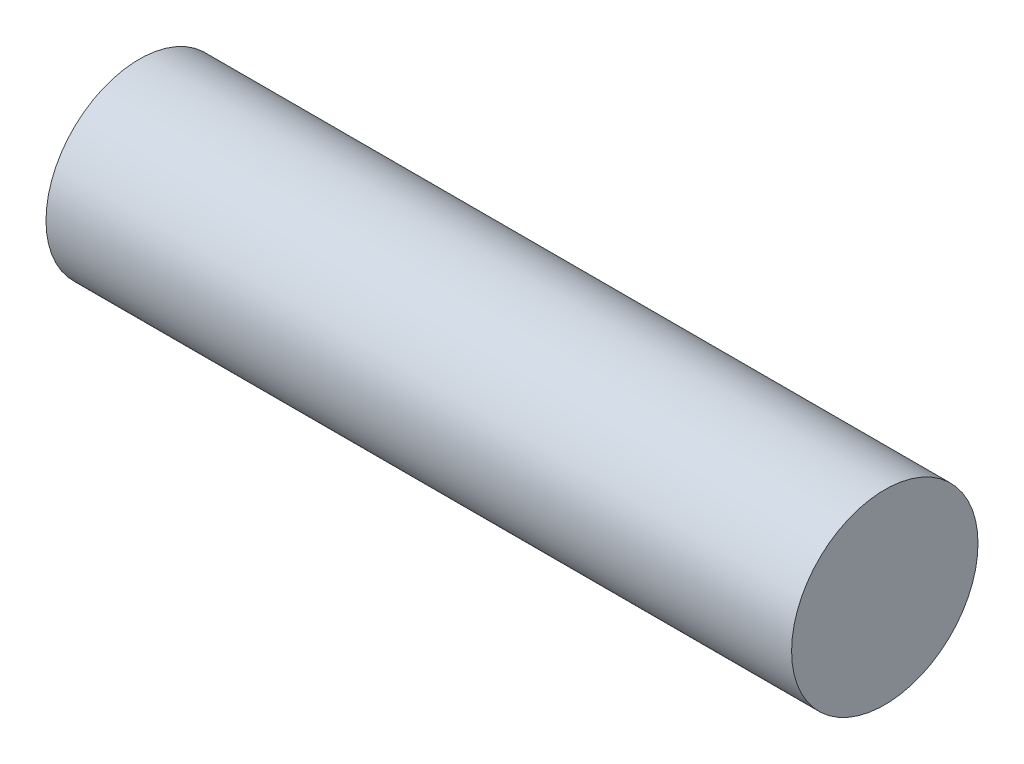
from build123d import *

# Parameters (mm, degrees)
SKETCH1_R           = 6.35
BOSS_EXTRUDE1_DEPTH = 25.4


with BuildPart() as part:
    # Sketch1 → Boss-Extrude1 (new, symmetric)
    with BuildSketch(Plane(origin=(0, 0, 0), x_dir=(0, 0, -1), z_dir=(1, 0, 0))):
        Circle(SKETCH1_R)
    extrude(amount=BOSS_EXTRUDE1_DEPTH, both=True)


solid = part.part
